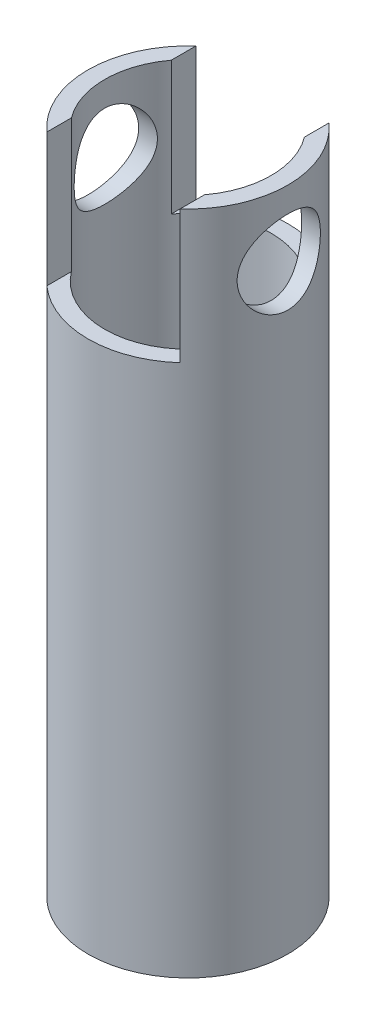
from build123d import *

# Parameters (mm, degrees)
SKETCH1_R           = 30
BOSS_EXTRUDE1_DEPTH = 200
SKETCH2_W           = 40
SKETCH2_H           = 40
CUT_EXTRUDE1_DEPTH  = 75
SKETCH3_R           = 25
CUT_EXTRUDE2_DEPTH  = 246
SKETCH4_R           = 12.5
CUT_EXTRUDE3_DEPTH  = 53


with BuildPart() as part:
    # Sketch1 → Boss-Extrude1 (new body)
    with BuildSketch(Plane(origin=(0, 0, 0), x_dir=(1, 0, 0), z_dir=(0, 1, 0))):
        Circle(SKETCH1_R)
    extrude(amount=BOSS_EXTRUDE1_DEPTH)

    # Sketch2 → Cut-Extrude1 (cut, symmetric)
    with BuildSketch(Plane.XY):
        with Locations((0, 180)):
            Rectangle(SKETCH2_W, SKETCH2_H)
    extrude(amount=CUT_EXTRUDE1_DEPTH, both=True, mode=Mode.SUBTRACT)

    # Sketch3 → Cut-Extrude2 (cut)
    with BuildSketch(Plane.XZ):
        Circle(SKETCH3_R)
    extrude(amount=-CUT_EXTRUDE2_DEPTH, mode=Mode.SUBTRACT)

    # Sketch4 → Cut-Extrude3 (cut, symmetric)
    with BuildSketch(Plane(origin=(0, 0, 0), x_dir=(0, 0, -1), z_dir=(1, 0, 0))):
        with Locations((0, 180)):
            Circle(SKETCH4_R)
    extrude(amount=CUT_EXTRUDE3_DEPTH, both=True, mode=Mode.SUBTRACT)


solid = part.part
